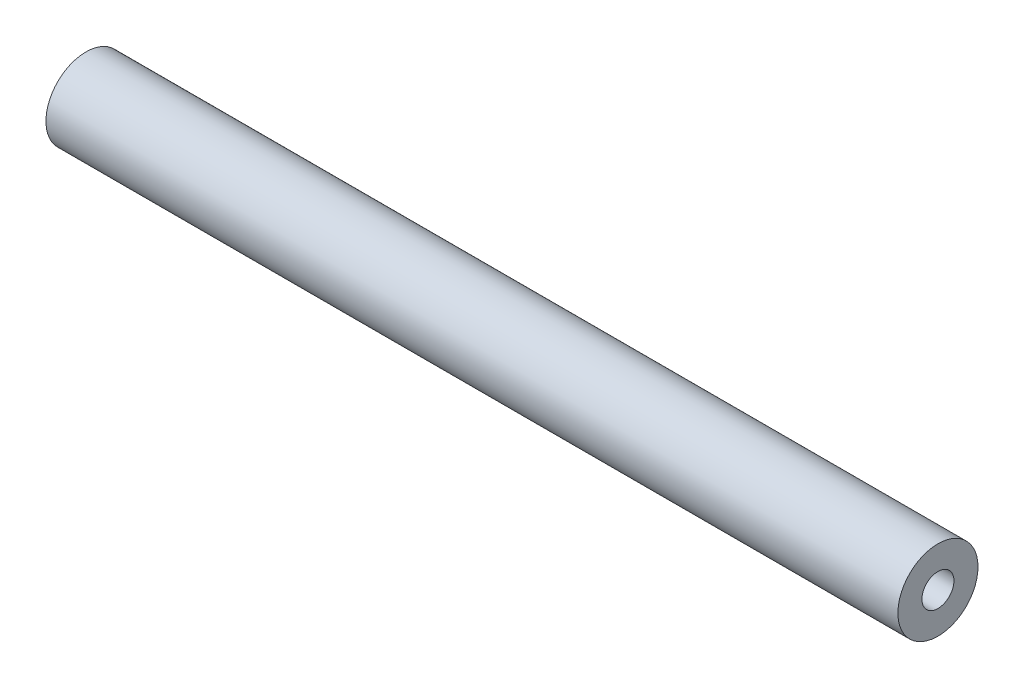
from build123d import *

# Parameters (mm, degrees)
CROQUIS2_R            = 2
CORTAR_EXTRUIR1_DEPTH = 10


with BuildPart() as part:
    # Croquis1 → Revolución1 (revolve)
    with BuildSketch(Plane(origin=(0, 0, 0), x_dir=(1, 0, 0), z_dir=(0, 1, 0))):
        Polygon((-53.175, 0), (53.175, 0), (53.175, 5), (9.995, 5), (-10, 5), (-53.175, 5), align=None)
    revolve(axis=Axis((53.175, 0, 0), (-1, 0, 0)))

    # Croquis2 → Cortar-Extruir1 (cut)
    with BuildSketch(Plane.ZY.offset(53.175)):
        Circle(CROQUIS2_R)
    cortar_extruir1 = extrude(amount=-CORTAR_EXTRUIR1_DEPTH, mode=Mode.SUBTRACT)

    # Simetría1: Cortar-Extruir1 across plane
    add(cortar_extruir1.mirror(Plane.ZY.offset(-3.175)), mode=Mode.SUBTRACT)


solid = part.part
